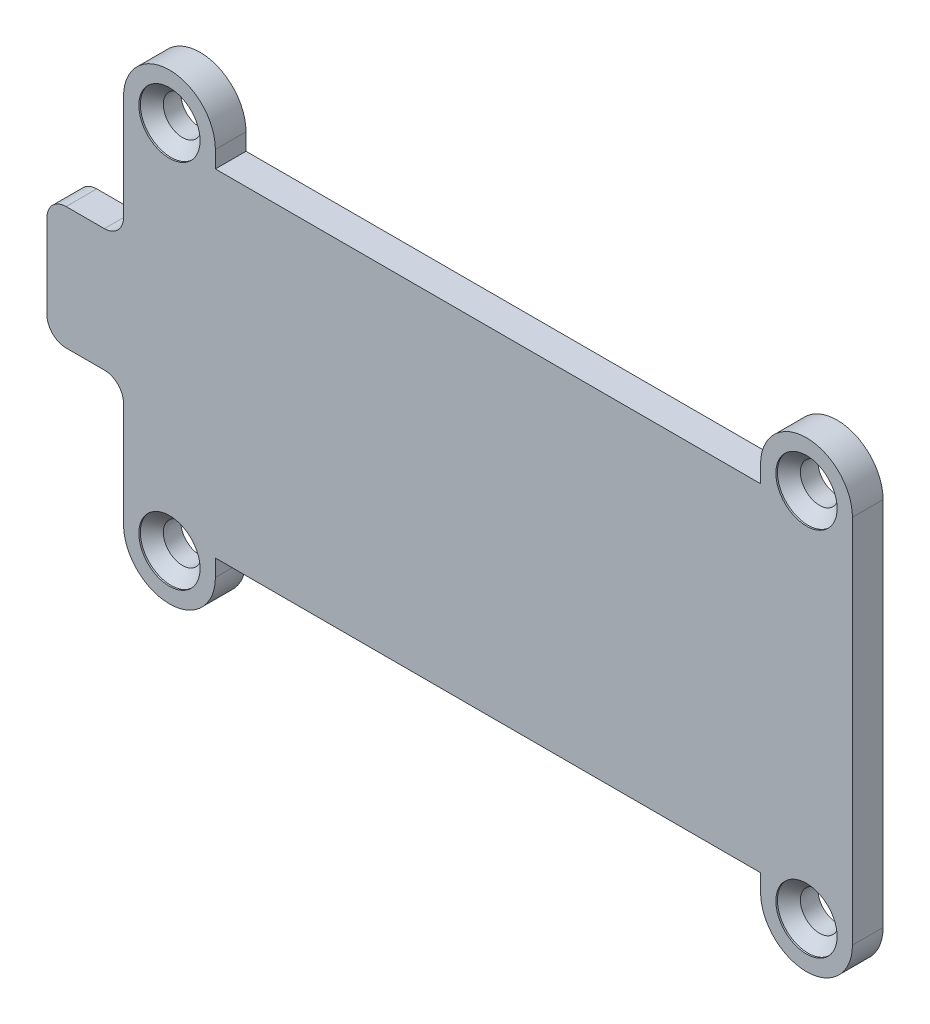
from build123d import *

# Parameters (mm, degrees)
SKETCH1_R                                      = 1.25
BOSS_EXTRUDE1_DEPTH                            = 2
CSK_FOR_M2_FLAT_HEAD_MACHINE_SCREW1_AT_2_COUNT = 2
CSK_FOR_M2_FLAT_HEAD_MACHINE_SCREW1_AT_2_PITCH = 41.6
CSK_FOR_M2_FLAT_HEAD_MACHINE_SCREW1_AT_3_COUNT = 2
CSK_FOR_M2_FLAT_HEAD_MACHINE_SCREW1_AT_3_PITCH = 48.126915546
CSK_FOR_M2_FLAT_HEAD_MACHINE_SCREW1_AT_4_COUNT = 2
CSK_FOR_M2_FLAT_HEAD_MACHINE_SCREW1_AT_4_PITCH = 24.2


with BuildPart() as part:
    # Sketch1 → Boss-Extrude1 (new body)
    with BuildSketch(Plane.XY):
        with BuildLine():
            Line((-28.8, 2.25), (-28.8, -2.25))
            Line((-28.8, -2.25), (-28.8, -2.75))
            ThreePointArc((-28.8, -2.75), (-28.433883476, -3.633883476), (-27.55, -4))
            Line((-27.55, -4), (-25.05, -4))
            ThreePointArc((-25.05, -4), (-24.166116524, -4.366116524), (-23.8, -5.25))
            Line((-23.8, -5.25), (-23.8, -12.1))
            ThreePointArc((-23.8, -12.1), (-20.8, -15.1), (-17.8, -12.1))
            Line((-17.8, -12.1), (-17.8, -11))
            Line((-17.8, -11), (17.8, -11))
            Line((17.8, -11), (17.8, -12.1))
            ThreePointArc((17.8, -12.1), (20.8, -15.1), (23.8, -12.1))
            Line((23.8, -12.1), (23.8, 12.1))
            ThreePointArc((23.8, 12.1), (20.8, 15.1), (17.8, 12.1))
            Line((17.8, 12.1), (17.8, 11))
            Line((17.8, 11), (-17.8, 11))
            Line((-17.8, 11), (-17.8, 12.1))
            ThreePointArc((-17.8, 12.1), (-20.8, 15.1), (-23.8, 12.1))
            Line((-23.8, 12.1), (-23.8, 5.25))
            ThreePointArc((-23.8, 5.25), (-24.166116524, 4.366116524), (-25.05, 4))
            Line((-25.05, 4), (-27.55, 4))
            ThreePointArc((-27.55, 4), (-28.433883476, 3.633883476), (-28.8, 2.75))
            Line((-28.8, 2.75), (-28.8, 2.25))
        make_face()
        with Locations((-20.8, 12.1)):
            Circle(SKETCH1_R, mode=Mode.SUBTRACT)
        with Locations((20.8, 12.1)):
            Circle(SKETCH1_R, mode=Mode.SUBTRACT)
        with Locations((20.8, -12.1)):
            Circle(SKETCH1_R, mode=Mode.SUBTRACT)
        with Locations((-20.8, -12.1)):
            Circle(SKETCH1_R, mode=Mode.SUBTRACT)
    extrude(amount=BOSS_EXTRUDE1_DEPTH)

    # Sketch3 → CSK for M2 Flat Head Machine Screw1 (revolve, cut)
    with BuildSketch(Plane(origin=(-20.8, 12.1, 2), x_dir=(0, -1, 0), z_dir=(1, 0, 0))):
        Polygon((0, 0), (0, 4.400860619), (1, 3.8), (1, 1.1), (2, 0.1), (2, 0), align=None)
    csk_for_m2_flat_head_machine_screw1 = revolve(axis=Axis((-20.8, 12.1, 8.35), (0, 0, -1)), mode=Mode.SUBTRACT)

    # CSK for M2 Flat Head Machine Screw1 at 2: CSK for M2 Flat Head Machine Screw1 ×2
    with Locations(*[(i * CSK_FOR_M2_FLAT_HEAD_MACHINE_SCREW1_AT_2_PITCH, 0, 0) for i in range(1, CSK_FOR_M2_FLAT_HEAD_MACHINE_SCREW1_AT_2_COUNT)]):
        add(csk_for_m2_flat_head_machine_screw1, mode=Mode.SUBTRACT)

    # CSK for M2 Flat Head Machine Screw1 at 3: CSK for M2 Flat Head Machine Screw1 ×2
    with Locations(*[Vector(0.8643811789680428, -0.5028371281496786, 0) * (i * CSK_FOR_M2_FLAT_HEAD_MACHINE_SCREW1_AT_3_PITCH) for i in range(1, CSK_FOR_M2_FLAT_HEAD_MACHINE_SCREW1_AT_3_COUNT)]):
        add(csk_for_m2_flat_head_machine_screw1, mode=Mode.SUBTRACT)

    # CSK for M2 Flat Head Machine Screw1 at 4: CSK for M2 Flat Head Machine Screw1 ×2
    with Locations(*[(0, -i * CSK_FOR_M2_FLAT_HEAD_MACHINE_SCREW1_AT_4_PITCH, 0) for i in range(1, CSK_FOR_M2_FLAT_HEAD_MACHINE_SCREW1_AT_4_COUNT)]):
        add(csk_for_m2_flat_head_machine_screw1, mode=Mode.SUBTRACT)


solid = part.part
